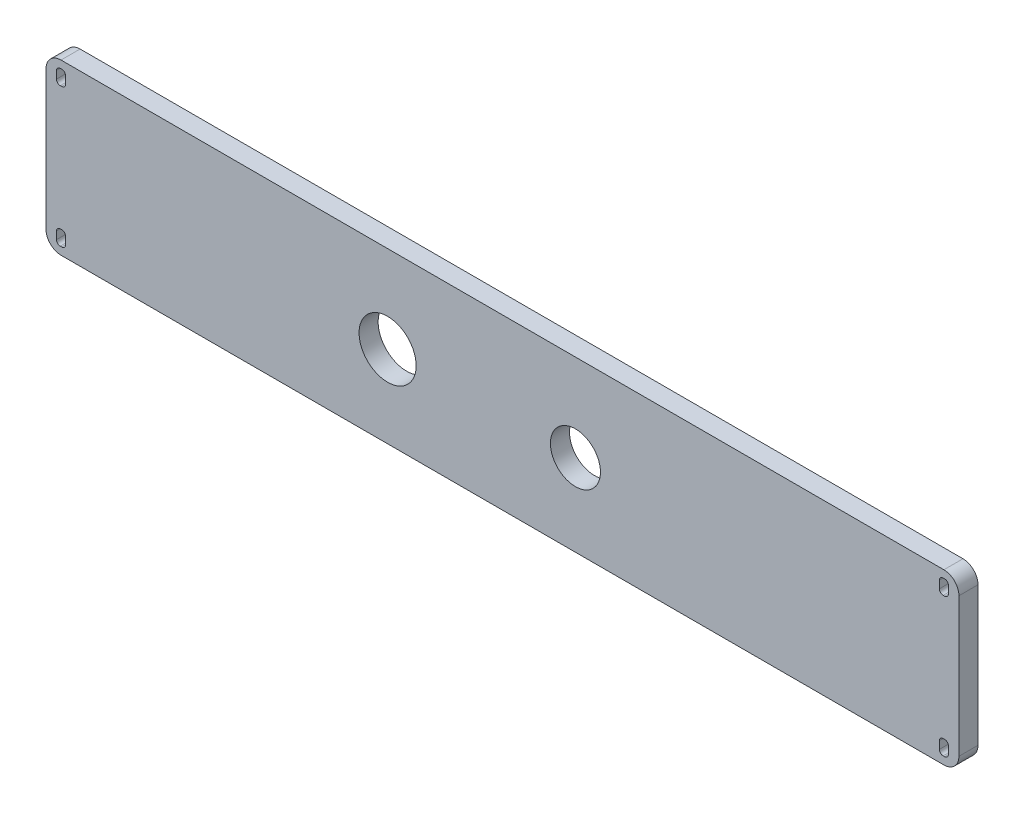
from build123d import *

# Parameters (mm, degrees)
SKETCH1_W           = 607.568
SKETCH1_H           = 112.522
SKETCH1_R           = 16.65
SKETCH1_R_2         = 19
BOSS_EXTRUDE1_DEPTH = 12.7
FILLET1_R           = 10


with BuildPart() as part:
    # Sketch1 → Boss-Extrude1 (new body)
    with BuildSketch(Plane.XY):
        with Locations((40.068414536, 75.801223419)):
            Rectangle(SKETCH1_W, SKETCH1_H)
        with Locations((88.632564672, 74.018682095)):
            Circle(SKETCH1_R, mode=Mode.SUBTRACT)
        with Locations((-36.367435328, 74.018682095)):
            Circle(SKETCH1_R_2, mode=Mode.SUBTRACT)
        with BuildLine():
            Line((334.352414536, 24.540223419), (333.352414536, 24.540223419))
            ThreePointArc((333.352414536, 24.540223419), (331.584647583, 25.272456466), (330.852414536, 27.040223419))
            Line((330.852414536, 27.040223419), (330.852414536, 32.040223419))
            ThreePointArc((330.852414536, 32.040223419), (331.584647583, 33.807990372), (333.352414536, 34.540223419))
            Line((333.352414536, 34.540223419), (334.352414536, 34.540223419))
            ThreePointArc((334.352414536, 34.540223419), (336.120181489, 33.807990372), (336.852414536, 32.040223419))
            Line((336.852414536, 32.040223419), (336.852414536, 27.040223419))
            ThreePointArc((336.852414536, 27.040223419), (336.120181489, 25.272456466), (334.352414536, 24.540223419))
        make_face(mode=Mode.SUBTRACT)
        with BuildLine():
            Line((-253.217585464, 24.540223419), (-254.217585464, 24.540223419))
            ThreePointArc((-254.217585464, 24.540223419), (-255.985352417, 25.272456466), (-256.717585464, 27.040223419))
            Line((-256.717585464, 27.040223419), (-256.717585464, 32.040223419))
            ThreePointArc((-256.717585464, 32.040223419), (-255.985352417, 33.807990372), (-254.217585464, 34.540223419))
            Line((-254.217585464, 34.540223419), (-253.217585464, 34.540223419))
            ThreePointArc((-253.217585464, 34.540223419), (-251.449818511, 33.807990372), (-250.717585464, 32.040223419))
            Line((-250.717585464, 32.040223419), (-250.717585464, 27.040223419))
            ThreePointArc((-250.717585464, 27.040223419), (-251.449818511, 25.272456466), (-253.217585464, 24.540223419))
        make_face(mode=Mode.SUBTRACT)
        with BuildLine():
            Line((-253.217585464, 117.060223419), (-254.217585464, 117.060223419))
            ThreePointArc((-254.217585464, 117.060223419), (-255.985352417, 117.792456466), (-256.717585464, 119.560223419))
            Line((-256.717585464, 119.560223419), (-256.717585464, 124.560223419))
            ThreePointArc((-256.717585464, 124.560223419), (-255.985352417, 126.327990372), (-254.217585464, 127.060223419))
            Line((-254.217585464, 127.060223419), (-253.217585464, 127.060223419))
            ThreePointArc((-253.217585464, 127.060223419), (-251.449818511, 126.327990372), (-250.717585464, 124.560223419))
            Line((-250.717585464, 124.560223419), (-250.717585464, 119.560223419))
            ThreePointArc((-250.717585464, 119.560223419), (-251.449818511, 117.792456466), (-253.217585464, 117.060223419))
        make_face(mode=Mode.SUBTRACT)
        with BuildLine():
            Line((334.352414536, 117.060223419), (333.352414536, 117.060223419))
            ThreePointArc((333.352414536, 117.060223419), (331.584647583, 117.792456466), (330.852414536, 119.560223419))
            Line((330.852414536, 119.560223419), (330.852414536, 124.560223419))
            ThreePointArc((330.852414536, 124.560223419), (331.584647583, 126.327990372), (333.352414536, 127.060223419))
            Line((333.352414536, 127.060223419), (334.352414536, 127.060223419))
            ThreePointArc((334.352414536, 127.060223419), (336.120181489, 126.327990372), (336.852414536, 124.560223419))
            Line((336.852414536, 124.560223419), (336.852414536, 119.560223419))
            ThreePointArc((336.852414536, 119.560223419), (336.120181489, 117.792456466), (334.352414536, 117.060223419))
        make_face(mode=Mode.SUBTRACT)
    extrude(amount=BOSS_EXTRUDE1_DEPTH)

    # Fillet1
    fillet1_edges = [part.edges().sort_by_distance(p)[0] for p in [
        (343.852414536, 19.540223419, 6.35),
        (343.852414536, 132.062223419, 6.35),
        (-263.715585464, 19.540223419, 6.35),
        (-263.715585464, 132.062223419, 6.35),
    ]]
    fillet(fillet1_edges, radius=FILLET1_R)


solid = part.part
